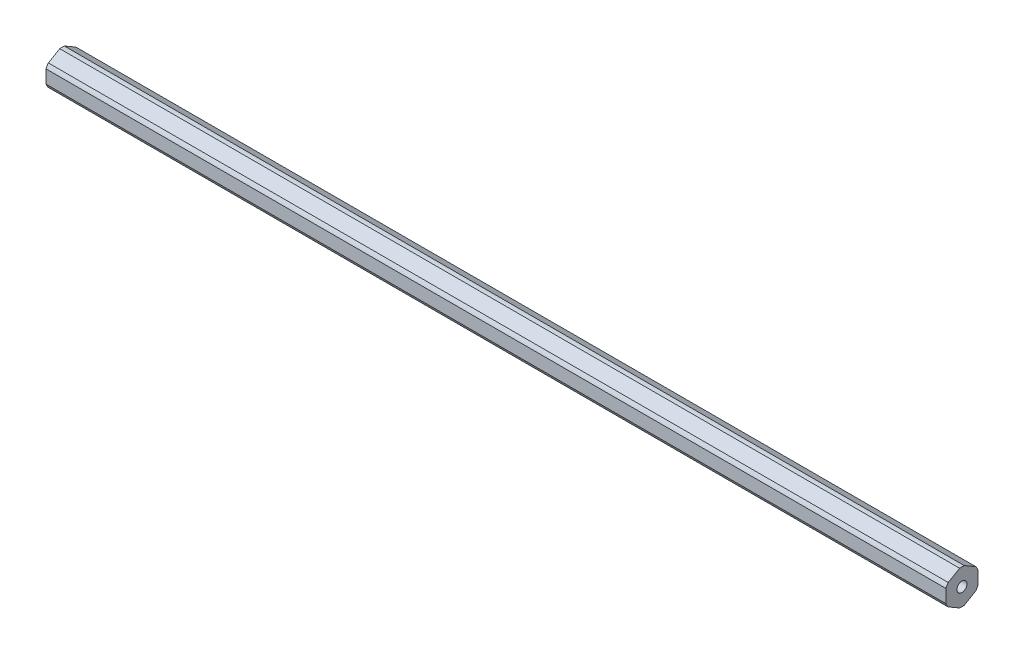
from build123d import *

# Parameters (mm, degrees)
SKETCH1_R           = 1.9939
BOSS_EXTRUDE1_DEPTH = 355.6


with BuildPart() as part:
    # Sketch1 → Boss-Extrude1 (new body)
    with BuildSketch(Plane(origin=(914.4, 0, 0), x_dir=(0, 0, -1), z_dir=(1, 0, 0))):
        with BuildLine():
            Line((-5.43426841, -4.194872089), (-0.91573159, -6.803650539))
            ThreePointArc((-0.91573159, -6.803650539), (0, -6.865), (0.91573159, -6.803650539))
            Line((0.91573159, -6.803650539), (5.43426841, -4.194872089))
            ThreePointArc((5.43426841, -4.194872089), (5.945264397, -3.4325), (6.35, -2.60877845))
            Line((6.35, -2.60877845), (6.35, 2.60877845))
            ThreePointArc((6.35, 2.60877845), (5.945264397, 3.4325), (5.43426841, 4.194872089))
            Line((5.43426841, 4.194872089), (0.91573159, 6.803650539))
            ThreePointArc((0.91573159, 6.803650539), (0, 6.865), (-0.91573159, 6.803650539))
            Line((-0.91573159, 6.803650539), (-5.43426841, 4.194872089))
            ThreePointArc((-5.43426841, 4.194872089), (-5.945264397, 3.4325), (-6.35, 2.60877845))
            Line((-6.35, 2.60877845), (-6.35, -2.60877845))
            ThreePointArc((-6.35, -2.60877845), (-5.945264397, -3.4325), (-5.43426841, -4.194872089))
        make_face()
        Circle(SKETCH1_R, mode=Mode.SUBTRACT)
    extrude(amount=-BOSS_EXTRUDE1_DEPTH)


solid = part.part
